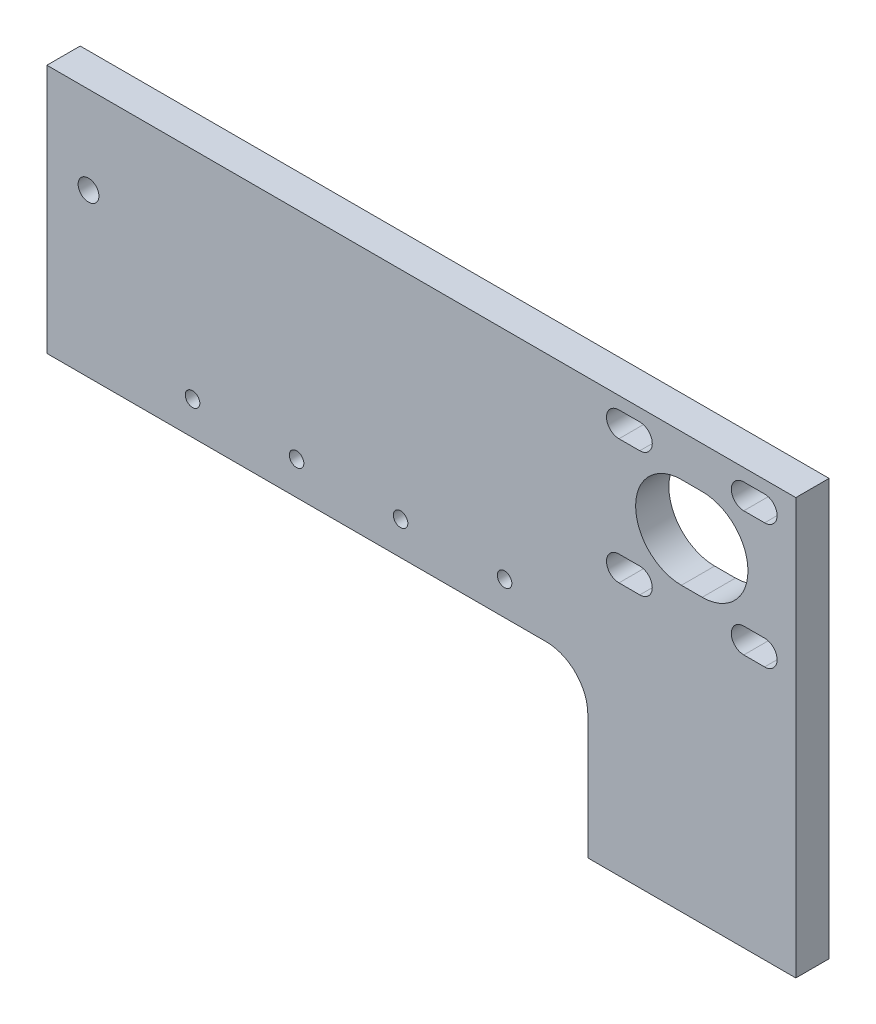
from build123d import *

# Parameters (mm, degrees)
BODY_DEPTH           = 8
CUT_EXTRUDE1_DEPTH   = 10
LPATTERN1_COUNT      = 2
LPATTERN1_PITCH      = 30
LPATTERN1_COUNT_DIR2 = 2
LPATTERN1_PITCH_DIR2 = 30
CUT_EXTRUDE2_DEPTH   = 210.925042967
SKETCH7_R            = 1.75
CUT_EXTRUDE3_DEPTH   = 207.067949958
LPATTERN2_COUNT      = 4
LPATTERN2_PITCH      = 25
SKETCH8_R            = 2.5
CUT_EXTRUDE4_DEPTH   = 207.067949958


with BuildPart() as part:
    # Sketch1 → BODY (new body)
    with BuildSketch(Plane.XY):
        with BuildLine():
            Line((-180, 100), (0, 100))
            Line((0, 100), (0, 0))
            Line((0, 0), (-50, 0))
            Line((-50, 0), (-50, 30))
            ThreePointArc((-50, 30), (-52.928932188, 37.071067812), (-60, 40))
            Line((-60, 40), (-180, 40))
            Line((-180, 40), (-180, 100))
        make_face()
    extrude(amount=BODY_DEPTH)

    # Sketch4 → Cut-Extrude1 (cut)
    with BuildSketch(Plane(origin=(-127.594252111, -66.505947319, 8), x_dir=(1, 0, 0), z_dir=(0, 0, 1))):
        with BuildLine():
            Line((85.094252111, 163.505947319), (90.094252111, 163.505947319))
            ThreePointArc((90.094252111, 163.505947319), (93.094252111, 160.505947319), (90.094252111, 157.505947319))
            Line((90.094252111, 157.505947319), (85.094252111, 157.505947319))
            ThreePointArc((85.094252111, 157.505947319), (82.094252111, 160.505947319), (85.094252111, 163.505947319))
        make_face()
    cut_extrude1 = extrude(amount=-CUT_EXTRUDE1_DEPTH, mode=Mode.SUBTRACT)

    # LPattern1: Cut-Extrude1 2 × 2
    with Locations(*[(j * LPATTERN1_PITCH_DIR2, -i * LPATTERN1_PITCH, 0) for i in range(LPATTERN1_COUNT) for j in range(LPATTERN1_COUNT_DIR2) if (i, j) != (0, 0)]):
        add(cut_extrude1, mode=Mode.SUBTRACT)

    # Sketch6 → Cut-Extrude2 (cut, through all)
    with BuildSketch(Plane(origin=(-127.594252111, -66.505947319, 8), x_dir=(1, 0, 0), z_dir=(0, 0, 1))):
        with BuildLine():
            Line((100.094252111, 156.505947319), (105.094252111, 156.505947319))
            ThreePointArc((105.094252111, 156.505947319), (116.094252111, 145.505947319), (105.094252111, 134.505947319))
            Line((105.094252111, 134.505947319), (100.094252111, 134.505947319))
            ThreePointArc((100.094252111, 134.505947319), (89.094252111, 145.505947319), (100.094252111, 156.505947319))
        make_face()
    extrude(amount=-CUT_EXTRUDE2_DEPTH, mode=Mode.SUBTRACT)

    # Sketch7 → Cut-Extrude3 (cut, through all)
    with BuildSketch(Plane.XY.offset(8)):
        with Locations((-70, 48)):
            Circle(SKETCH7_R)
    cut_extrude3 = extrude(amount=-CUT_EXTRUDE3_DEPTH, mode=Mode.SUBTRACT)

    # LPattern2: Cut-Extrude3 ×4
    with Locations(*[(-i * LPATTERN2_PITCH, 0, 0) for i in range(1, LPATTERN2_COUNT)]):
        add(cut_extrude3, mode=Mode.SUBTRACT)

    # Sketch8 → Cut-Extrude4 (cut, through all)
    with BuildSketch(Plane.XY.offset(8)):
        with Locations((-170, 79)):
            Circle(SKETCH8_R)
    extrude(amount=-CUT_EXTRUDE4_DEPTH, mode=Mode.SUBTRACT)


solid = part.part
